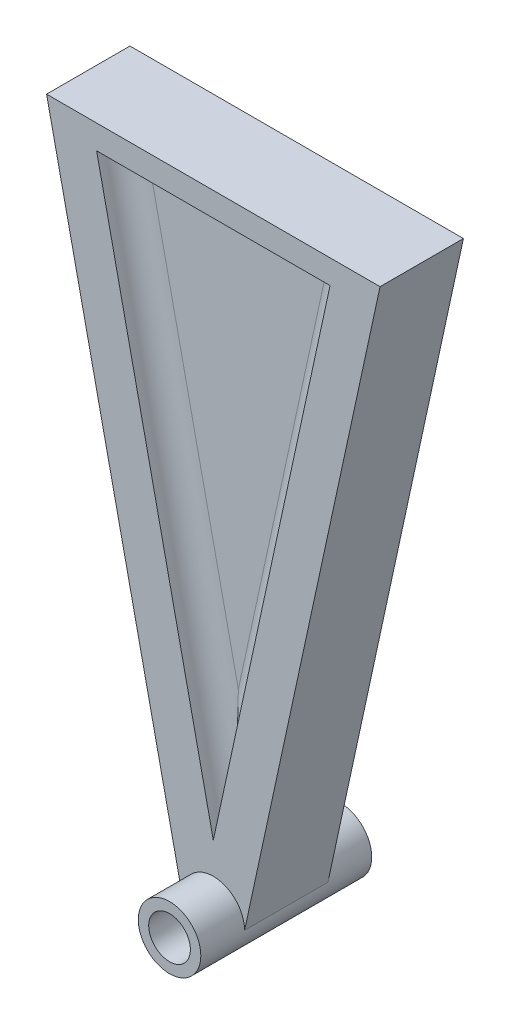
from build123d import *

# Parameters (mm, degrees)
SKETCH1_R           = 7.5
SKETCH1_R_2         = 5
BOSS_EXTRUDE1_DEPTH = 41
SKETCH2_W           = 80
SKETCH2_H           = 20
BOSS_EXTRUDE2_DEPTH = 150
SKETCH3_R           = 5
CUT_EXTRUDE1_DEPTH  = 150
CUT_EXTRUDE2_DEPTH  = 150
CUT_EXTRUDE3_DEPTH  = 6
FILLET1_R           = 6


with BuildPart() as part:
    # Sketch1 → Boss-Extrude1 (new body)
    with BuildSketch(Plane.XY):
        Circle(SKETCH1_R)
        Circle(SKETCH1_R_2, mode=Mode.SUBTRACT)
    extrude(amount=BOSS_EXTRUDE1_DEPTH)

    # Sketch2 → Boss-Extrude2 (add)
    with BuildSketch(Plane(origin=(0, 0, 0), x_dir=(1, 0, 0), z_dir=(0, 1, 0))):
        with Locations((0, -20.5)):
            Rectangle(SKETCH2_W, SKETCH2_H)
    extrude(amount=BOSS_EXTRUDE2_DEPTH)

    # Sketch3 → Cut-Extrude1 (cut)
    with BuildSketch(Plane(origin=(0, 0, 0), x_dir=(-1, 0, 0), z_dir=(0, 0, -1))):
        with Locations(Location((0, 0, 0), (0, 0, 180))):
            Circle(SKETCH3_R)
    extrude(amount=-CUT_EXTRUDE1_DEPTH, mode=Mode.SUBTRACT)

    # Sketch4 → Cut-Extrude2 (cut)
    with BuildSketch(Plane(origin=(0, 0, 10.5), x_dir=(-1, 0, 0), z_dir=(0, 0, -1))):
        Polygon((7.5, 0), (40, 150), (40, 0), align=None)
    cut_extrude2 = extrude(amount=-CUT_EXTRUDE2_DEPTH, mode=Mode.SUBTRACT)

    # Mirror1: Cut-Extrude2 across plane
    add(cut_extrude2.mirror(Plane(origin=(0, 0, 0), x_dir=(0, 0, 1), z_dir=(1, 0, 0))), mode=Mode.SUBTRACT)

    # Sketch5 → Cut-Extrude3 (cut)
    with BuildSketch(Plane.XY.offset(30.5)):
        Polygon((-28, 144.230769231), (0, 15), (28, 144.230769231), align=None)
    cut_extrude3 = extrude(amount=-CUT_EXTRUDE3_DEPTH, mode=Mode.SUBTRACT)

    # Mirror2: Cut-Extrude3 across plane
    add(cut_extrude3.mirror(Plane.XY.offset(20)), mode=Mode.SUBTRACT)

    # Fillet1
    # the kernel refuses this fillet: 6 mm, written as the material it adds along each edge
    with BuildSketch(Plane(origin=(-3.176300205, 0.3401529, 24.5), x_dir=(0, 0, 1), z_dir=(0.21175334700580606, 0.9773231400267973, 0))) as fillet1_piece_1_section:
        with BuildLine():
            CenterArc((FILLET1_R, -FILLET1_R), FILLET1_R, 90, 90)
            Line((0, -FILLET1_R), (0, 0))
            Line((0, 0), (FILLET1_R, 0))
        make_face()
    fillet1_piece_1 = extrude(amount=162.229314889, mode=Mode.PRIVATE)
    fillet1_piece_1 = split(fillet1_piece_1, bisect_by=Plane(origin=(-13.111456884, 75.514416388, 25.854154081), z_dir=(0.9773231400267973, 0.21175334700580611, 0)), keep=Keep.TOP, mode=Mode.PRIVATE)
    fillet1_piece_1 = split(fillet1_piece_1, bisect_by=Plane(origin=(12.989714393, 144.230769231, 25.854154081), z_dir=(0, -1, 0)), keep=Keep.TOP, mode=Mode.PRIVATE)
    add(fillet1_piece_1)
    with BuildSketch(Plane(origin=(-31.176300205, 158.890616331, 24.5), x_dir=(0, 0, 1), z_dir=(0.21175334700580611, -0.9773231400267973, 0))) as fillet1_piece_2_section:
        with BuildLine():
            CenterArc((FILLET1_R, -FILLET1_R), FILLET1_R, 90, 90)
            Line((0, -FILLET1_R), (0, 0))
            Line((0, 0), (FILLET1_R, 0))
        make_face()
    fillet1_piece_2 = extrude(amount=162.229314889, mode=Mode.PRIVATE)
    fillet1_piece_2 = split(fillet1_piece_2, bisect_by=Plane(origin=(13.111456884, 75.514416388, 25.854154081), z_dir=(-0.9773231400267973, 0.21175334700580606, 0)), keep=Keep.TOP, mode=Mode.PRIVATE)
    fillet1_piece_2 = split(fillet1_piece_2, bisect_by=Plane(origin=(-12.989714393, 144.230769231, 25.854154081), z_dir=(0, -1, 0)), keep=Keep.TOP, mode=Mode.PRIVATE)
    add(fillet1_piece_2)
    with BuildSketch(Plane(origin=(43, 144.230769231, 24.5), x_dir=(0, 0, 1), z_dir=(-1, 0, 0))) as fillet1_piece_3_section:
        with BuildLine():
            CenterArc((FILLET1_R, -FILLET1_R), FILLET1_R, 90, 90)
            Line((0, -FILLET1_R), (0, 0))
            Line((0, 0), (FILLET1_R, 0))
        make_face()
    fillet1_piece_3 = extrude(amount=86, mode=Mode.PRIVATE)
    fillet1_piece_3 = split(fillet1_piece_3, bisect_by=Plane(origin=(-26.469184818, 137.165468391, 25.846029793), z_dir=(0.9773231400267973, 0.21175334700580611, 0)), keep=Keep.TOP, mode=Mode.PRIVATE)
    fillet1_piece_3 = split(fillet1_piece_3, bisect_by=Plane(origin=(26.469184818, 137.165468391, 25.846029793), z_dir=(-0.9773231400267973, 0.21175334700580606, 0)), keep=Keep.TOP, mode=Mode.PRIVATE)
    add(fillet1_piece_3)
    with BuildSketch(Plane(origin=(-3.131874238, 0.545195824, 15.5), x_dir=(0, 0, -1), z_dir=(0.21175334700580606, 0.9773231400267973, 0))) as fillet1_piece_4_section:
        with BuildLine():
            CenterArc((6, 5.916079783), FILLET1_R, 180, 80.405931773)
            Line((0, 5.916079783), (0, 0))
            Line((0, 0), (5, 0))
        make_face()
    fillet1_piece_4 = extrude(amount=161.809713804, mode=Mode.PRIVATE)
    fillet1_piece_4 = split(fillet1_piece_4, bisect_by=Plane(origin=(12.010804887, 144.230769231, 14.091740846), z_dir=(0, -1, 0)), keep=Keep.TOP, mode=Mode.PRIVATE)
    fillet1_piece_4 = split(fillet1_piece_4, bisect_by=Plane(origin=(-12.92288351, 74.644077737, 14.091740846), z_dir=(0.9773231400267973, 0.21175334700580611, 0)), keep=Keep.TOP, mode=Mode.PRIVATE)
    add(fillet1_piece_4)
    with BuildSketch(Plane(origin=(-31.131874238, 158.685573406, 15.5), x_dir=(0, 0, -1), z_dir=(0.21175334700580611, -0.9773231400267973, 0))) as fillet1_piece_5_section:
        with BuildLine():
            CenterArc((6, 5.916079783), FILLET1_R, 180, 80.405931773)
            Line((0, 5.916079783), (0, 0))
            Line((0, 0), (5, 0))
        make_face()
    fillet1_piece_5 = extrude(amount=161.809713804, mode=Mode.PRIVATE)
    fillet1_piece_5 = split(fillet1_piece_5, bisect_by=Plane(origin=(-12.010804887, 144.230769231, 14.091740846), z_dir=(0, -1, 0)), keep=Keep.TOP, mode=Mode.PRIVATE)
    fillet1_piece_5 = split(fillet1_piece_5, bisect_by=Plane(origin=(12.92288351, 74.644077737, 14.091740846), z_dir=(-0.9773231400267973, 0.21175334700580606, 0)), keep=Keep.TOP, mode=Mode.PRIVATE)
    add(fillet1_piece_5)
    with BuildSketch(Plane(origin=(42.790199458, 144.230769231, 15.5), x_dir=(0, 0, -1), z_dir=(-1, 0, 0))) as fillet1_piece_6_section:
        with BuildLine():
            CenterArc((6, 5.916079783), FILLET1_R, 180, 80.405931773)
            Line((0, 5.916079783), (0, 0))
            Line((0, 0), (5, 0))
        make_face()
    fillet1_piece_6 = extrude(amount=85.580398916, mode=Mode.PRIVATE)
    fillet1_piece_6 = split(fillet1_piece_6, bisect_by=Plane(origin=(26.323275838, 136.492042329, 14.091740846), z_dir=(-0.9773231400267973, 0.21175334700580606, 0)), keep=Keep.TOP, mode=Mode.PRIVATE)
    fillet1_piece_6 = split(fillet1_piece_6, bisect_by=Plane(origin=(-26.323275838, 136.492042329, 14.091740846), z_dir=(0.9773231400267973, 0.21175334700580611, 0)), keep=Keep.TOP, mode=Mode.PRIVATE)
    add(fillet1_piece_6)


solid = part.part
